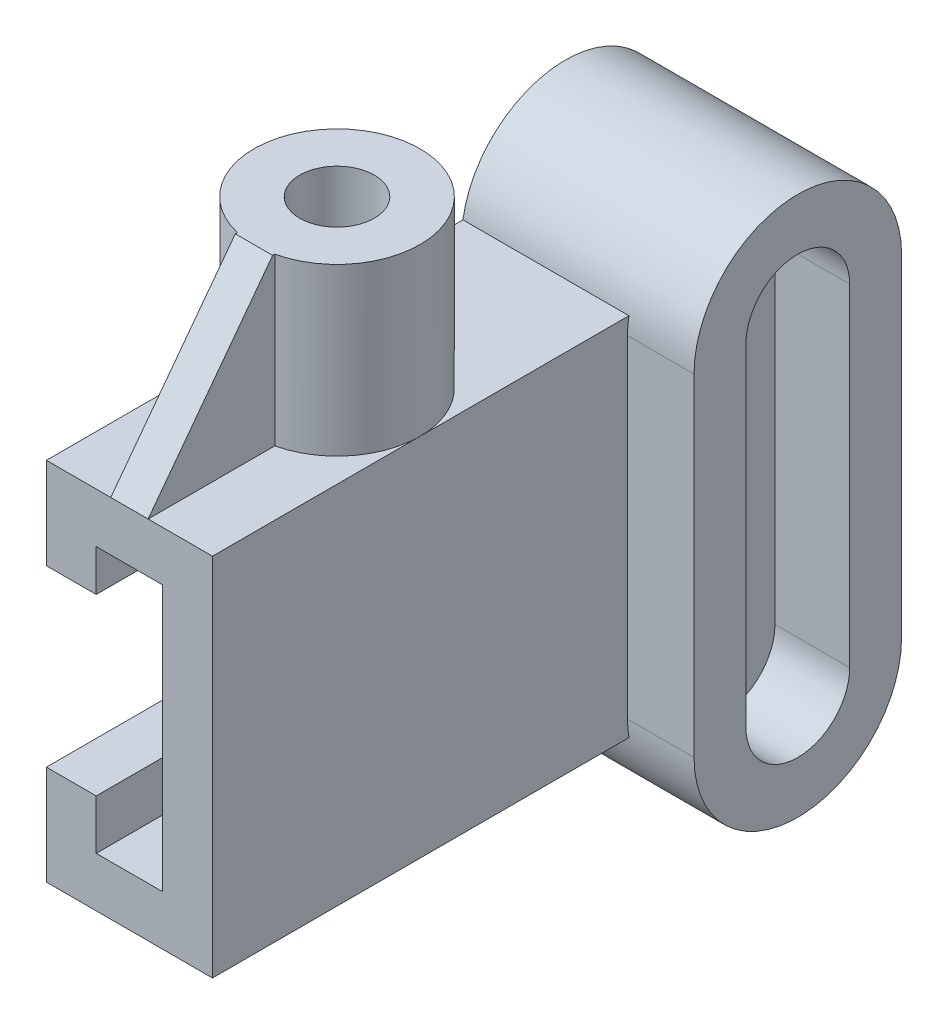
from build123d import *

# Parameters (mm, degrees)
BOSS_EXTRUDE1_DEPTH        = 56
BOSS_EXTRUDE2_DEPTH        = 38
BOSS_EXTRUDE3_START        = -0.322075
BOSS_EXTRUDE3_DEPTH        = 100.322075
SKETCH3_R                  = 20
BOSS_EXTRUDE4_DEPTH        = 40
RIB2_START                 = -4.5
RIB2_DEPTH                 = 9
F_10_0MM_DOWEL_HOLE1_D     = 18
F_10_0MM_DOWEL_HOLE1_DEPTH = 32
F_10_0MM_DOWEL_HOLE1_TIP   = 5.407745571


with BuildPart() as part:
    # Sketch1 → Boss-Extrude1 (new body)
    with BuildSketch(Plane(origin=(0, 0, 0), x_dir=(0, 0, -1), z_dir=(1, 0, 0))):
        with BuildLine():
            Line((-25, -40), (-25, 40))
            ThreePointArc((-25, 40), (0, 65), (25, 40))
            Line((25, 40), (25, -40))
            ThreePointArc((25, -40), (0, -65), (-25, -40))
        make_face()
        with BuildLine():
            Line((-12.5, -40), (-12.5, 40))
            ThreePointArc((-12.5, 40), (0, 52.5), (12.5, 40))
            Line((12.5, 40), (12.5, -40))
            ThreePointArc((12.5, -40), (0, -52.5), (-12.5, -40))
        make_face(mode=Mode.SUBTRACT)
    extrude(amount=BOSS_EXTRUDE1_DEPTH)

    # Sketch1<2> → Boss-Extrude2 (add)
    with BuildSketch(Plane(origin=(0, 0, 0), x_dir=(0, 0, -1), z_dir=(1, 0, 0))):
        with BuildLine():
            Line((12.5, -40), (12.5, 40))
            ThreePointArc((12.5, 40), (0, 52.5), (-12.5, 40))
            Line((-12.5, 40), (-12.5, -40))
            ThreePointArc((-12.5, -40), (0, -52.5), (12.5, -40))
        make_face()
    extrude(amount=BOSS_EXTRUDE2_DEPTH)

    # Sketch2 → Boss-Extrude3 (add)
    with BuildSketch(Plane.XY.offset(25).offset(BOSS_EXTRUDE3_START)):
        Polygon((0, 22), (0, 44), (40, 44), (40, -44), (0, -44), (0, -20.015625235), (12, -20.015625235), (12, -32), (28, -32), (28, 32), (12, 32), (12, 22), align=None)
    extrude(amount=BOSS_EXTRUDE3_DEPTH)

    # Sketch3 → Boss-Extrude4 (add)
    with BuildSketch(Plane(origin=(0, 44, 0), x_dir=(1, 0, 0), z_dir=(0, 1, 0))):
        with Locations(Location((20, -75, 0), (0, 0, 180))):
            Circle(SKETCH3_R)
    extrude(amount=BOSS_EXTRUDE4_DEPTH)

    # Rib2: read off the stored shape, not the designer's step
    # Rib2 outline → Rib2 (add)
    with BuildSketch(Plane(origin=(20, 0, 0), x_dir=(0, 0, -1), z_dir=(1, 0, 0)).offset(RIB2_START)):
        Polygon((-125, 44), (-94.48717527, 44), (-94.48717527, 84), (-95, 84), align=None)
    extrude(amount=RIB2_DEPTH)

    # Ø10.0mm Dowel Hole1
    with Locations(Plane(origin=(20, 84, 75), x_dir=(1, 0, 0), z_dir=(0, 1, 0))):
        with Locations((0, 0)):
            Hole(F_10_0MM_DOWEL_HOLE1_D / 2, depth=F_10_0MM_DOWEL_HOLE1_DEPTH)
            with Locations((0, 0, -(F_10_0MM_DOWEL_HOLE1_DEPTH + F_10_0MM_DOWEL_HOLE1_TIP / 2))):  # 118° drill point
                Cone(0, F_10_0MM_DOWEL_HOLE1_D / 2, F_10_0MM_DOWEL_HOLE1_TIP, mode=Mode.SUBTRACT)


solid = part.part
